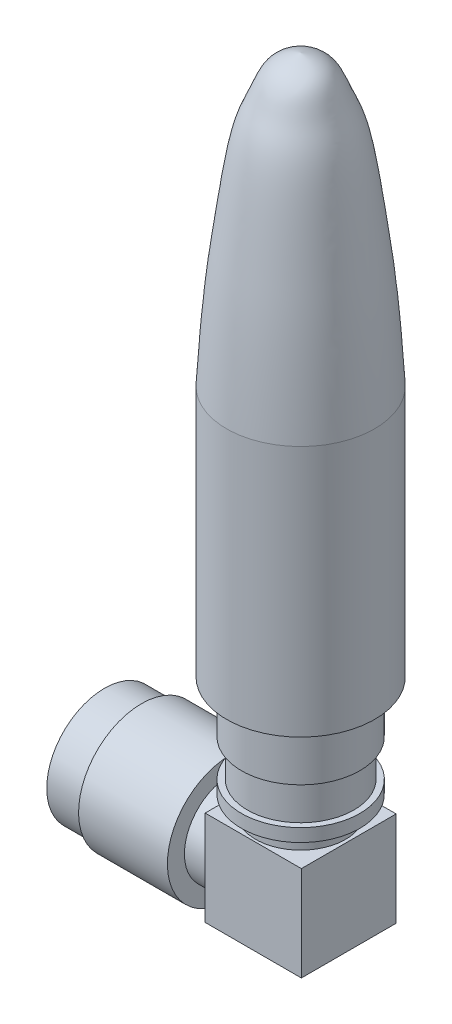
from build123d import *

# Parameters (mm, degrees)
SKETCH_2_W          = 6.5
SKETCH_2_H          = 6.4
EXTRUDE_1_DEPTH     = 6.4
SKETCH_5_R          = 2.7
CUT_EXTRUDE_1_DEPTH = 5


with BuildPart() as part:
    # 草图1 → 旋转1 (revolve)
    with BuildSketch(Plane.XY):
        with BuildLine():
            Line((0, 0), (-3.036670619, 0))
            Line((-3.036670619, 0), (-3.036670619, 1.125720416))
            Line((-3.036670619, 1.125720416), (-4, 1.125720416))
            Line((-4, 1.125720416), (-4, 2))
            Line((-4, 2), (-3.6, 2))
            Line((-3.6, 2), (-3.6, 4.5))
            Line((-3.6, 4.5), (-4, 4.5))
            Line((-4, 4.5), (-4, 8))
            Line((-4, 8), (-5, 8))
            Line((-5, 8), (-5, 25))
            add(Edge.make_bspline(
                [(-5, 25), (-4.722166372, 30.033496439), (-3.774780509, 37.406959566), (-3.370776113, 40.075486719), (-1.977019792, 43.14029628), (-1.896061892, 44.030808648), (0, 44.5)],
                knots=[0, 0, 0, 0, 0.132032401, 0.478362498, 0.569488384, 1, 1, 1, 1], degree=3))
            Line((0, 44.5), (0, 0))
        make_face()
    revolve(axis=Axis((0, -22.695068061, 0), (0, 1, 0)))

    # 草图2 → 凸台-拉伸1 (add)
    with BuildSketch(Plane.XZ):
        Rectangle(SKETCH_2_W, SKETCH_2_H)
    extrude(amount=EXTRUDE_1_DEPTH)

    # 草图4 → 旋转4 (revolve)
    with BuildSketch(Plane.XY):
        Polygon((-3.25, -0.1), (-4.75, -0.1), (-4.75, 1.05), (-10.75, 1.05), (-10.75, 0.7), (-13.25, 0.7), (-13.25, -3.2), (-3.25, -3.2), align=None)
    revolve(axis=Axis((-3.25, -3.2, 0), (-1, 0, 0)))

    # 草图5 → 切除-拉伸1 (cut)
    with BuildSketch(Plane.ZY.offset(13.25)):
        with Locations((0, -3.2)):
            Circle(SKETCH_5_R)
    extrude(amount=-CUT_EXTRUDE_1_DEPTH, mode=Mode.SUBTRACT)


solid = part.part
